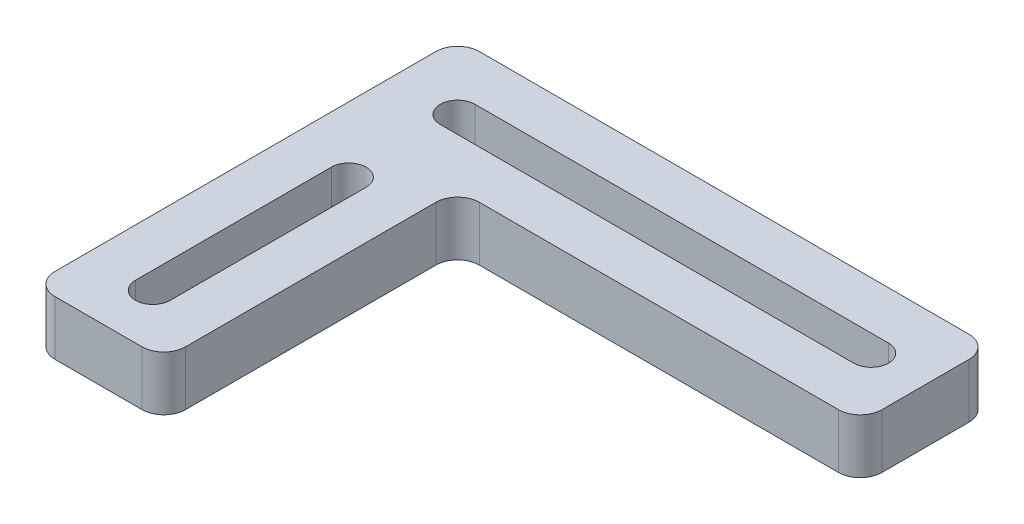
from build123d import *

# Parameters (mm, degrees)
BOSS_EXTRUDE1_DEPTH = 5


with BuildPart() as part:
    # Sketch1 → Boss-Extrude1 (new body)
    with BuildSketch(Plane(origin=(0, 0, 0), x_dir=(1, 0, 0), z_dir=(0, 1, 0))):
        with BuildLine():
            ThreePointArc((-2, 0), (-1.414213562, -1.414213562), (0, -2))
            Line((0, -2), (8, -2))
            ThreePointArc((8, -2), (9.414213562, -1.414213562), (10, 0))
            Line((10, 0), (10, 23))
            ThreePointArc((10, 23), (10.585786438, 24.414213562), (12, 25))
            Line((12, 25), (45, 25))
            ThreePointArc((45, 25), (46.414213562, 25.585786438), (47, 27))
            Line((47, 27), (47, 35))
            ThreePointArc((47, 35), (46.414213562, 36.414213562), (45, 37))
            Line((45, 37), (0, 37))
            ThreePointArc((0, 37), (-1.414213562, 36.414213562), (-2, 35))
            Line((-2, 35), (-2, 0))
        make_face()
        with BuildLine():
            ThreePointArc((5.6, 3), (4, 1.4), (2.4, 3))
            Line((2.4, 3), (2.4, 21))
            ThreePointArc((2.4, 21), (4, 22.6), (5.6, 21))
            Line((5.6, 21), (5.6, 3))
        make_face(mode=Mode.SUBTRACT)
        with BuildLine():
            ThreePointArc((42, 32.6), (43.6, 31), (42, 29.4))
            Line((42, 29.4), (4, 29.4))
            ThreePointArc((4, 29.4), (2.4, 31), (4, 32.6))
            Line((4, 32.6), (42, 32.6))
        make_face(mode=Mode.SUBTRACT)
    extrude(amount=BOSS_EXTRUDE1_DEPTH)


solid = part.part
